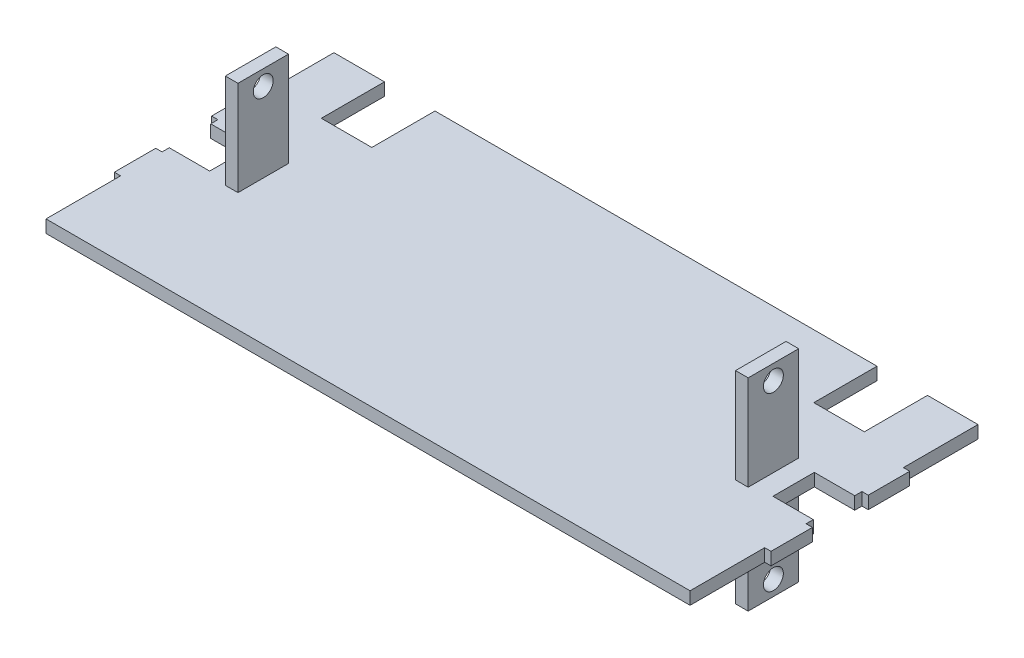
from build123d import *

# Parameters (mm, degrees)
BOSS_EXTRUDE1_DEPTH     = 3.175
SKETCH2_W               = 6.35
SKETCH2_H               = 25.4
BOSS_EXTRUDE2_DEPTH     = 50.8
CUT_EXTRUDE1_DEPTH      = 310.45094785
CUT_EXTRUDE1_DEPTH_BACK = 310.45094785
SKETCH3_R               = 5.0038


with BuildPart() as part:
    # Sketch1 → Boss-Extrude1 (new, symmetric)
    with BuildSketch(Plane(origin=(0, 0, 0), x_dir=(1, 0, 0), z_dir=(0, 1, 0))):
        Polygon((161.925, -72.39), (-161.925, -72.39), (-161.925, -34.874677354), (-165.1, -34.874677354), (-165.1, -14.046677354), (-161.925, -14.046677354), (-161.925, -10.414), (-141.605, -10.414), (-141.605, 10.414), (-161.925, 10.414), (-161.925, 14.046677354), (-165.1, 14.046677354), (-165.1, 34.874677354), (-161.925, 34.874677354), (-161.925, 72.39), (-136.525, 72.39), (-136.525, 40.64), (-111.125, 40.64), (-111.125, 72.39), (111.125, 72.39), (111.125, 40.64), (136.525, 40.64), (136.525, 72.39), (161.925, 72.39), (161.925, 34.874677354), (165.1, 34.874677354), (165.1, 14.046677354), (161.925, 14.046677354), (161.925, 10.414), (141.605, 10.414), (141.605, -10.414), (161.925, -10.414), (161.925, -14.046677354), (165.1, -14.046677354), (165.1, -34.874677354), (161.925, -34.874677354), align=None)
    extrude(amount=BOSS_EXTRUDE1_DEPTH, both=True)

    # Sketch2 → Boss-Extrude2 (add, symmetric)
    with BuildSketch(Plane(origin=(0, 0, 0), x_dir=(1, 0, 0), z_dir=(0, 1, 0))):
        with Locations((128.27, 0)):
            Rectangle(SKETCH2_W, SKETCH2_H)
        with Locations((-128.27, 0)):
            Rectangle(SKETCH2_W, SKETCH2_H)
    extrude(amount=BOSS_EXTRUDE2_DEPTH, both=True)

    # Sketch3 → Cut-Extrude1 (cut, two sides: drawn at the far end of the back side and taken through both)
    with BuildSketch(Plane.ZY.offset(131.445).offset(-CUT_EXTRUDE1_DEPTH_BACK)):
        with Locations((0, 43.18)):
            Circle(SKETCH3_R)
        with Locations((0, -43.18)):
            Circle(SKETCH3_R)
    extrude(amount=CUT_EXTRUDE1_DEPTH + CUT_EXTRUDE1_DEPTH_BACK, mode=Mode.SUBTRACT)


solid = part.part
